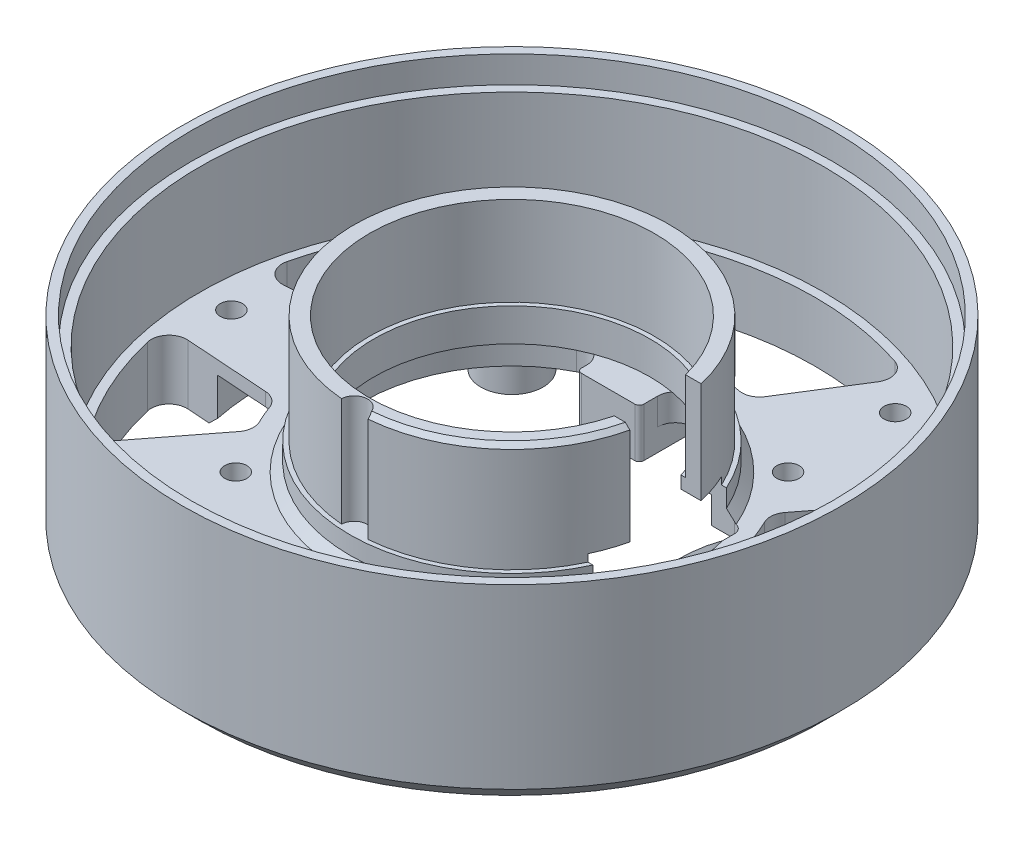
from build123d import *

# Parameters (mm, degrees)
CUT_EXTRUDE2_REACH              = 56.688
SKETCH2_R                       = 1.5000000000000016
CUT_EXTRUDE2_DIRECTION_2_REACH  = 56.688
BOSS_EXTRUDE1_START             = -10.7
SKETCH3_R                       = 3.4999999999999996
BOSS_EXTRUDE1_DEPTH             = 4
M3X0_5_TAPPED_HOLE1_D           = 2.5
M3X0_5_TAPPED_HOLE1_CSINK_D     = 3.2
M3X0_5_TAPPED_HOLE1_CSINK_ANGLE = 90
BOSS_EXTRUDE2_START             = -7.7
BOSS_EXTRUDE2_DEPTH             = 5.5
CUT_EXTRUDE5_DEPTH              = 55.68829856559812
CUT_EXTRUDE5_DEPTH_BACK         = 55.68829856559812
CHAMFER1_SIZE                   = 0.5
M3X0_5_TAPPED_HOLE2_D           = 2.5
M3X0_5_TAPPED_HOLE2_CSINK_D     = 3.2
M3X0_5_TAPPED_HOLE2_CSINK_ANGLE = 90
CIRPATTERN2_COUNT               = 6
CUT_EXTRUDE6_DEPTH              = 55.68829856559812
FILLET1_R                       = 2
CUT_EXTRUDE7_START              = -10.7
CUT_EXTRUDE7_DEPTH              = 5.319999999999999
CHAMFER2_SIZE                   = 1


with BuildPart() as part:
    # Sketch1 → Revolve1 (revolve)
    with BuildSketch(Plane.XY, mode=Mode.PRIVATE) as revolve1_sk:
        Polygon((-17.7, 5.999999999999998), (-17.7, -6.1999999999999975), (-18.2, -6.1999999999999975), (-18.200000000000003, -8.2), (-19.200000000000003, -9.200000000000001), (-35, -9.200000000000001), (-35, 2.9999999999999956), (-36, 2.9999999999999956), (-36, 5.999999999999996), (-37.00000000000001, 5.999999999999996), (-37, -13.9), (-35, -15.9), (-27.999999999999996, -15.9), (-27.999999999999996, -10.7), (-16.7, -10.7), (-16.7, -7.699999999999998), (-15.5, -7.699999999999998), (-15.5, -3.99999999999996), (-16, -3.99999999999996), (-16, 5.999999999999998), align=None)
    revolve(revolve1_sk.sketch.rotate(Axis((0, 0, 0), (0, -1, 0)), 270), axis=Axis((0, 0, 0), (0, -1, 0)))

    # Sketch2 → Cut-Extrude2 (cut, up to next)
    with BuildSketch(Plane(origin=(0, 0, 0), x_dir=(1, 0, 0), z_dir=(0, 1, 0)), mode=Mode.PRIVATE) as cut_extrude2_sk1:
        with Locations((0, -17.7)):
            Circle(SKETCH2_R)
    cut_extrude2_tool1 = extrude(cut_extrude2_sk1.sketch, amount=CUT_EXTRUDE2_REACH, mode=Mode.PRIVATE) & part.part
    add(cut_extrude2_tool1.solids().sort_by_distance((0, 0, 17.7))[0], mode=Mode.SUBTRACT)

    # Cut-Extrude2 direction 2: up to this face of the body (flat: up to its plane)
    cut_extrude2_direction_2_end = Plane(part.part.faces().sort_by_distance((0, -6.2, -17.751477374))[0])
    # Sketch2 → Cut-Extrude2 direction 2 (cut, up to the picked face)
    with BuildSketch(Plane(origin=(0, 0, 0), x_dir=(1, 0, 0), z_dir=(0, 1, 0)), mode=Mode.PRIVATE) as cut_extrude2_direction_2_sk1:
        with Locations((0, -17.7)):
            Circle(SKETCH2_R)
    cut_extrude2_direction_2_tool1 = split(extrude(cut_extrude2_direction_2_sk1.sketch, amount=-CUT_EXTRUDE2_DIRECTION_2_REACH, mode=Mode.PRIVATE), bisect_by=cut_extrude2_direction_2_end, keep=Keep.BOTH, mode=Mode.PRIVATE)
    add(cut_extrude2_direction_2_tool1.solids().sort_by(Axis((0, 0, 17.7), (0, -1, 0)))[0], mode=Mode.SUBTRACT)

    # Sketch3 → Boss-Extrude1 (add)
    with BuildSketch(Plane(origin=(0, 0, 0), x_dir=(1, 0, 0), z_dir=(0, 1, 0)).offset(BOSS_EXTRUDE1_START)):
        with Locations(Location((-15.49999999999999, -15.5, 0), (0, 0, 270))):
            Circle(SKETCH3_R)
        with Locations(Location((15.499999999999996, -15.499999999999993, 0), (0, 0, 270))):
            Circle(SKETCH3_R)
        with Locations(Location((15.5, 15.499999999999996, 0), (0, 0, 270))):
            Circle(SKETCH3_R)
        with Locations(Location((-15.5, 15.499999999999996, 0), (0, 0, 270))):
            Circle(SKETCH3_R)
    extrude(amount=-BOSS_EXTRUDE1_DEPTH)

    # M3x0.5 Tapped Hole1 (through all)
    with Locations(Plane(origin=(0, -14.700000000000001, 0), x_dir=(-1, 0, 0), z_dir=(0, -1, 0))):
        with Locations((-15.5, 15.5), (15.5, 15.5), (15.5, -15.5), (-15.5, -15.5)):
            CounterSinkHole(M3X0_5_TAPPED_HOLE1_D / 2, M3X0_5_TAPPED_HOLE1_CSINK_D / 2, counter_sink_angle=M3X0_5_TAPPED_HOLE1_CSINK_ANGLE)

    # Sketch7 → Boss-Extrude2 (add)
    with BuildSketch(Plane(origin=(0, 0, 0), x_dir=(1, 0, 0), z_dir=(0, 1, 0)).offset(BOSS_EXTRUDE2_START)):
        with BuildLine():
            Line((-4.1999999999999975, 12), (1.8000000000000016, 12))
            ThreePointArc((1.8000000000000016, 12), (2.1535533905932756, 12.146446609406727), (2.3000000000000025, 12.5))
            Line((2.3000000000000025, 12.5), (2.300000000000003, 18.5))
            ThreePointArc((2.300000000000003, 18.5), (2.153553390593277, 18.853553390593273), (1.800000000000003, 19))
            Line((1.800000000000003, 19), (-4.1999999999999975, 19))
            ThreePointArc((-4.1999999999999975, 19), (-4.5535533905932715, 18.853553390593273), (-4.6999999999999975, 18.5))
            Line((-4.6999999999999975, 18.5), (-4.6999999999999975, 12.5))
            ThreePointArc((-4.6999999999999975, 12.5), (-4.5535533905932715, 12.146446609406727), (-4.1999999999999975, 12))
        make_face()
    extrude(amount=-BOSS_EXTRUDE2_DEPTH)

    # Sketch10 → Cut-Extrude5 (cut, two sides: drawn at the far end of the back side and taken through both)
    with BuildSketch(Plane(origin=(0, 0, 0), x_dir=(1, 0, 0), z_dir=(0, 1, 0)).offset(-CUT_EXTRUDE5_DEPTH_BACK)):
        with BuildLine():
            Line((14.499999999999998, 3.999999999999999), (17.5, 3.9999999999999982))
            ThreePointArc((17.5, 3.9999999999999982), (18.207106781186546, 3.707106781186546), (18.5, 2.999999999999999))
            Line((18.5, 2.999999999999999), (18.5, -3.000000000000001))
            ThreePointArc((18.5, -3.000000000000001), (18.20710678118655, -3.707106781186549), (17.5, -4.000000000000002))
            Line((17.5, -4.000000000000002), (14.499999999999998, -4.000000000000001))
            ThreePointArc((14.499999999999998, -4.000000000000001), (13.792893218813452, -3.707106781186547), (13.5, -3.000000000000001))
            Line((13.5, -3.000000000000001), (13.5, 2.999999999999999))
            ThreePointArc((13.5, 2.999999999999999), (13.79289321881345, 3.7071067811865466), (14.499999999999998, 3.999999999999999))
        make_face()
    extrude(amount=CUT_EXTRUDE5_DEPTH + CUT_EXTRUDE5_DEPTH_BACK, mode=Mode.SUBTRACT)

    # Chamfer1
    chamfer1_edges = [part.edges().sort_by_distance(p)[0] for p in [
        (11.588445930712233, 5.999999999999998, 13.379010460828525),
    ]]
    chamfer(chamfer1_edges, length=CHAMFER1_SIZE)

    # M3x0.5 Tapped Hole2 (through all)
    with Locations(Plane(origin=(0, -15.9, 0), x_dir=(-1, 0, 0), z_dir=(0, -1, 0))):
        with Locations((-31.5, 0)):
            m3x0_5_tapped_hole2 = CounterSinkHole(M3X0_5_TAPPED_HOLE2_D / 2, M3X0_5_TAPPED_HOLE2_CSINK_D / 2, counter_sink_angle=M3X0_5_TAPPED_HOLE2_CSINK_ANGLE)

    # CirPattern2: M3x0.5 Tapped Hole2 ×6 about axis
    cirpattern2_axis = Axis((-9.3e-16, 0, -3.728e-14), (0, 1, 0))
    for i in range(1, CIRPATTERN2_COUNT):
        add(m3x0_5_tapped_hole2.rotate(cirpattern2_axis, i * 360 / CIRPATTERN2_COUNT), mode=Mode.SUBTRACT)

    # Sketch13 → Cut-Extrude6 (cut, through all)
    with BuildSketch(Plane(origin=(0, 0, 0), x_dir=(1, 0, 0), z_dir=(0, 1, 0))):
        with BuildLine():
            Line((-11.773027420687583, 29.306703151937622), (-6.894494538528995, 21.545137951339427))
            ThreePointArc((-6.894494538528995, 21.545137951339427), (-5.964851777693605, 20.76098450867382), (-4.752825439264389, 20.660364235508567))
            ThreePointArc((-4.752825439264389, 20.660364235508567), (1.3e-15, 21.200000000000006), (4.752825439264389, 20.660364235508567))
            ThreePointArc((4.752825439264389, 20.660364235508567), (5.964851777693605, 20.76098450867382), (6.894494538528995, 21.545137951339427))
            Line((6.894494538528995, 21.545137951339427), (11.773027420687583, 29.306703151937622))
            ThreePointArc((11.773027420687583, 29.306703151937622), (11.96215934277389, 31.04666097841075), (10.7097217098344, 32.269209176828326))
            ThreePointArc((10.7097217098344, 32.269209176828326), (2.08e-15, 33.99999999999999), (-10.7097217098344, 32.269209176828326))
            ThreePointArc((-10.7097217098344, 32.269209176828326), (-11.96215934277389, 31.04666097841075), (-11.773027420687583, 29.306703151937622))
        make_face()
        with BuildLine():
            Line((11.77302742068759, -29.306703151937622), (6.894494538529, -21.545137951339427))
            ThreePointArc((6.894494538529, -21.545137951339427), (5.96485177769361, -20.76098450867382), (4.752825439264394, -20.660364235508567))
            ThreePointArc((4.752825439264394, -20.660364235508567), (1.3e-15, -21.200000000000006), (-4.752825439264394, -20.660364235508567))
            ThreePointArc((-4.752825439264394, -20.660364235508567), (-5.96485177769361, -20.76098450867382), (-6.894494538529, -21.545137951339427))
            Line((-6.894494538529, -21.545137951339427), (-11.77302742068759, -29.306703151937622))
            ThreePointArc((-11.77302742068759, -29.306703151937622), (-11.962159342773898, -31.04666097841075), (-10.709721709834408, -32.269209176828326))
            ThreePointArc((-10.709721709834408, -32.269209176828326), (2.08e-15, -34), (10.709721709834408, -32.269209176828326))
            ThreePointArc((10.709721709834408, -32.269209176828326), (11.962159342773898, -31.04666097841075), (11.77302742068759, -29.306703151937622))
        make_face()
        with BuildLine():
            Line((19.26644906790347, 11.399522324883955), (25.078575830648383, 18.920100507874288))
            ThreePointArc((25.078575830648383, 18.920100507874288), (26.733002594810113, 19.695809853045223), (28.3273840561073, 18.803172938038895))
            ThreePointArc((28.3273840561073, 18.803172938038895), (31.1952520838824, 13.522434966492932), (33.088650044367135, 7.819286300002263))
            ThreePointArc((33.088650044367135, 7.819286300002263), (32.667575875790234, 6.065725554517574), (31.006312684605312, 5.363953972618137))
            Line((31.006312684605312, 5.363953972618137), (21.642090677133144, 6.001944654745555))
            ThreePointArc((21.642090677133144, 6.001944654745555), (20.578126729623577, 6.397251564569373), (19.900619887313297, 7.3078949158202064))
            ThreePointArc((19.900619887313297, 7.3078949158202064), (19.50155312572882, 8.314410723820238), (19.051618120026195, 9.299239055357699))
            ThreePointArc((19.051618120026195, 9.299239055357699), (18.859321754192383, 10.380037211344689), (19.26644906790347, 11.399522324883955))
        make_face()
        with BuildLine():
            Line((31.006312684605312, -5.36395397261813), (21.642090677133144, -6.00194465474555))
            ThreePointArc((21.642090677133144, -6.00194465474555), (20.57812672962358, -6.397251564569369), (19.9006198873133, -7.307894915820201))
            ThreePointArc((19.9006198873133, -7.307894915820201), (19.501553125728822, -8.314410723820233), (19.0516181200262, -9.299239055357695))
            ThreePointArc((19.0516181200262, -9.299239055357695), (18.859321754192386, -10.380037211344685), (19.266449067903473, -11.399522324883952))
            Line((19.266449067903473, -11.399522324883952), (25.078575830648386, -18.92010050787428))
            ThreePointArc((25.078575830648386, -18.92010050787428), (26.733002594810117, -19.695809853045215), (28.327384056107302, -18.803172938038887))
            ThreePointArc((28.327384056107302, -18.803172938038887), (31.195252083882405, -13.522434966492925), (33.088650044367135, -7.819286300002256))
            ThreePointArc((33.088650044367135, -7.819286300002256), (32.667575875790234, -6.065725554517568), (31.006312684605312, -5.36395397261813))
        make_face()
        with BuildLine():
            Line((-19.266449067903466, -11.399522324883959), (-25.07857583064838, -18.920100507874295))
            ThreePointArc((-25.07857583064838, -18.920100507874295), (-26.73300259481011, -19.69580985304523), (-28.327384056107295, -18.8031729380389))
            ThreePointArc((-28.327384056107295, -18.8031729380389), (-31.195252083882405, -13.522434966492941), (-33.088650044367135, -7.819286300002269))
            ThreePointArc((-33.088650044367135, -7.819286300002269), (-32.667575875790234, -6.065725554517581), (-31.006312684605312, -5.363953972618144))
            Line((-31.006312684605312, -5.363953972618144), (-21.642090677133144, -6.00194465474556))
            ThreePointArc((-21.642090677133144, -6.00194465474556), (-20.578126729623577, -6.397251564569379), (-19.900619887313294, -7.307894915820212))
            ThreePointArc((-19.900619887313294, -7.307894915820212), (-19.50155312572881, -8.31441072382024), (-19.05161812002619, -9.299239055357702))
            ThreePointArc((-19.05161812002619, -9.299239055357702), (-18.85932175419238, -10.380037211344694), (-19.266449067903466, -11.399522324883959))
        make_face()
        with BuildLine():
            Line((-31.006312684605312, 5.363953972618137), (-21.642090677133144, 6.001944654745555))
            ThreePointArc((-21.642090677133144, 6.001944654745555), (-20.578126729623577, 6.397251564569373), (-19.900619887313297, 7.3078949158202064))
            ThreePointArc((-19.900619887313297, 7.3078949158202064), (-19.501553125728815, 8.314410723820242), (-19.051618120026195, 9.299239055357699))
            ThreePointArc((-19.051618120026195, 9.299239055357699), (-18.859321754192383, 10.38003721134469), (-19.26644906790347, 11.399522324883955))
            Line((-19.26644906790347, 11.399522324883955), (-25.078575830648383, 18.920100507874288))
            ThreePointArc((-25.078575830648383, 18.920100507874288), (-26.733002594810113, 19.695809853045223), (-28.3273840561073, 18.803172938038895))
            ThreePointArc((-28.3273840561073, 18.803172938038895), (-31.195252083882405, 13.522434966492925), (-33.088650044367135, 7.819286300002263))
            ThreePointArc((-33.088650044367135, 7.819286300002263), (-32.667575875790234, 6.065725554517574), (-31.006312684605312, 5.363953972618137))
        make_face()
    extrude(amount=-CUT_EXTRUDE6_DEPTH, mode=Mode.SUBTRACT)

    # Fillet1
    # the kernel refuses this fillet: 2 mm, written as the material it adds along each edge
    with BuildSketch(Plane(origin=(2.300000000000003, -10.7, -16.540858502508264), x_dir=(0.9764376402169549, 0, 0.21579975618045613), z_dir=(0, 1, 0))) as fillet1_piece_1:
        with BuildLine():
            CenterArc((2.4888855750797827, -1.9937073392295537), FILLET1_R, 85.45374567006199, 107.00870579100672)
            Line((0.536010294645873, -2.425306851590466), (0, 0))
            ThreePointArc((0, 0), (1.323706659357714, 0.05254371743322268), (2.647413318715439, 2e-17))
        make_face()
    extrude(amount=3)
    with BuildSketch(Plane(origin=(-4.6999999999999975, -10.7, -16.024980499208105), x_dir=(-0.9289347208682247, 0, 0.37024354736507337), z_dir=(0, 1, 0))) as fillet1_piece_2:
        with BuildLine():
            CenterArc((2.946621950049773, 1.9911743065349057), FILLET1_R, 158.26936173951248, 117.11528092219322)
            Line((1.088752508313324, 2.731661401265054), (0, 0))
            ThreePointArc((0, 0), (1.567152438402271, -0.07369454043352781), (3.134304876804534, -1.2e-16))
        make_face()
    extrude(amount=3)

    # Sketch14 → Cut-Extrude7 (cut)
    with BuildSketch(Plane(origin=(0, 0, 0), x_dir=(1, 0, 0), z_dir=(0, 1, 0)).offset(CUT_EXTRUDE7_START)):
        with BuildLine():
            Line((8.678914357930926, -7.5), (17.499999999999996, -7.5))
            ThreePointArc((17.499999999999996, -7.5), (18.207106781186543, -7.207106781186548), (18.5, -6.5))
            Line((18.5, -6.5), (18.5, 6.5))
            ThreePointArc((18.5, 6.5), (18.207106781186543, 7.207106781186548), (17.499999999999996, 7.5))
            Line((17.499999999999996, 7.5), (8.678914357930926, 7.5))
            ThreePointArc((8.678914357930926, 7.5), (7.971807576744379, 7.207106781186547), (7.6789143579309265, 6.499999999999999))
            Line((7.6789143579309265, 6.499999999999999), (7.6789143579309265, -6.499999999999999))
            ThreePointArc((7.6789143579309265, -6.499999999999999), (7.971807576744379, -7.207106781186547), (8.678914357930926, -7.5))
        make_face()
    extrude(amount=CUT_EXTRUDE7_DEPTH, mode=Mode.SUBTRACT)

    # Chamfer2
    chamfer2_edges = [part.edges().sort_by_distance(p)[0] for p in [
        (17.130543973511973, -15.9, 22.14823837625856),
        (27.999999999999996, -15.9, -1.136e-14),
        (17.130543973511976, -15.9, -22.148238376258558),
        (-17.13054397351197, -15.9, -22.148238376258565),
        (-27.999999999999996, -15.9, 7.93e-15),
        (-17.130543973511973, -15.9, 22.14823837625856),
    ]]
    chamfer(chamfer2_edges, length=CHAMFER2_SIZE)

    # Sketch16 → Cut-Revolve1 (revolve, cut)
    with BuildSketch(Plane.XY):
        Polygon((-17.7, -6.1999999999999975), (-18.2, -6.1999999999999975), (-18.200000000000003, -8.2), (-19.200000000000003, -9.200000000000001), (-23.33337257582576, -9.200000000000001), (-23.33337257582576, -3.0666274241742704), (-17.7, -3.066627424174271), align=None)
    revolve(axis=Axis((0, 0, 0), (0, 1, 0)), mode=Mode.SUBTRACT)


solid = part.part
